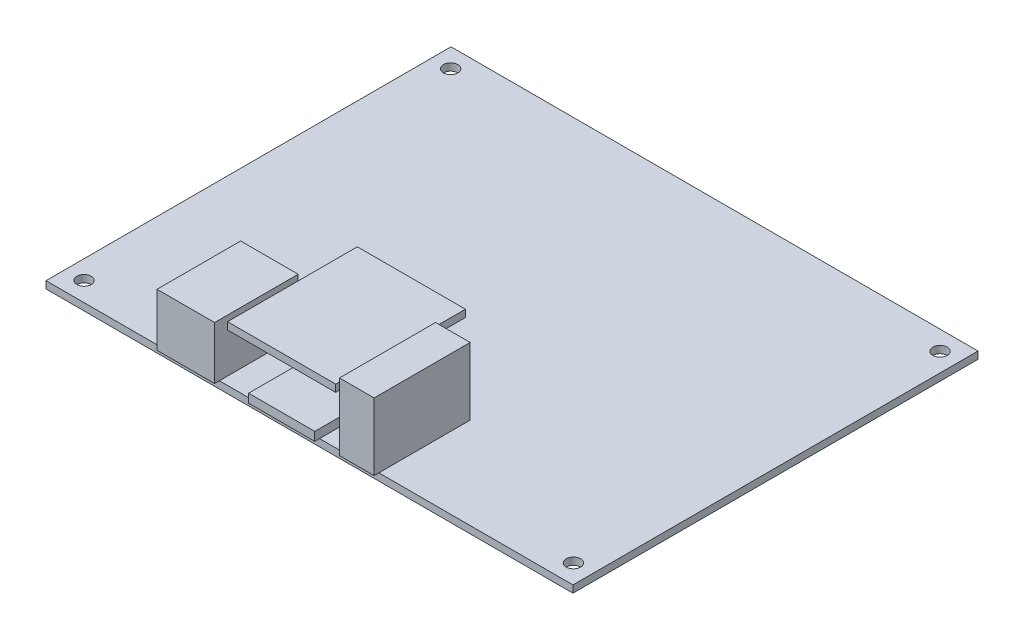
from build123d import *

# Parameters (mm, degrees)
SKETCH1_W           = 109.67
SKETCH1_H           = 84.3
SKETCH1_R           = 1.5
BOSS_EXTRUDE1_DEPTH = 1.5
SKETCH2_W           = 11.98
SKETCH2_H           = 17.4
BOSS_EXTRUDE2_DEPTH = 11
SKETCH3_W           = 13.76
SKETCH3_H           = 12
BOSS_EXTRUDE3_DEPTH = 1.8
SKETCH4_W           = 7.2
SKETCH4_H           = 20
BOSS_EXTRUDE4_DEPTH = 14
SKETCH5_W           = 22.5
SKETCH5_H           = 27
BOSS_EXTRUDE5_DEPTH = 1.5


with BuildPart() as part:
    # Sketch1 → Boss-Extrude1 (new body)
    with BuildSketch(Plane(origin=(0, 0, 0), x_dir=(1, 0, 0), z_dir=(0, 1, 0))):
        Rectangle(SKETCH1_W, SKETCH1_H)
        with Locations((-50.925, 38.15)):
            Circle(SKETCH1_R, mode=Mode.SUBTRACT)
        with Locations((-50.925, -38.15)):
            Circle(SKETCH1_R, mode=Mode.SUBTRACT)
        with Locations((50.925, -38.15)):
            Circle(SKETCH1_R, mode=Mode.SUBTRACT)
        with Locations((50.925, 38.15)):
            Circle(SKETCH1_R, mode=Mode.SUBTRACT)
    extrude(amount=-BOSS_EXTRUDE1_DEPTH)


with BuildPart() as body_2:
    # Sketch2 → Boss-Extrude2 (new body)
    with BuildSketch(Plane(origin=(0, 0, 0), x_dir=(1, 0, 0), z_dir=(0, 1, 0))):
        with Locations((-24.735, -34.45)):
            Rectangle(SKETCH2_W, SKETCH2_H)
    extrude(amount=BOSS_EXTRUDE2_DEPTH)


with BuildPart() as body_3:
    # Sketch3 → Boss-Extrude3 (new body)
    with BuildSketch(Plane(origin=(0, 0, 0), x_dir=(1, 0, 0), z_dir=(0, 1, 0))):
        with Locations((-4.785, -37.15)):
            Rectangle(SKETCH3_W, SKETCH3_H)
    extrude(amount=BOSS_EXTRUDE3_DEPTH)


with BuildPart() as body_4:
    # Sketch4 → Boss-Extrude4 (new body)
    with BuildSketch(Plane(origin=(0, 0, 0), x_dir=(1, 0, 0), z_dir=(0, 1, 0))):
        with Locations((10.845, -33.15)):
            Rectangle(SKETCH4_W, SKETCH4_H)
    extrude(amount=BOSS_EXTRUDE4_DEPTH)


with BuildPart() as body_5:
    # Sketch5 → Boss-Extrude5 (new body)
    with BuildSketch(Plane(origin=(0, 11, 0), x_dir=(1, 0, 0), z_dir=(0, 1, 0))):
        with Locations((-4.795, -29.65)):
            Rectangle(SKETCH5_W, SKETCH5_H)
    extrude(amount=BOSS_EXTRUDE5_DEPTH)


solid = Compound([part.part, body_2.part, body_3.part, body_4.part, body_5.part])
